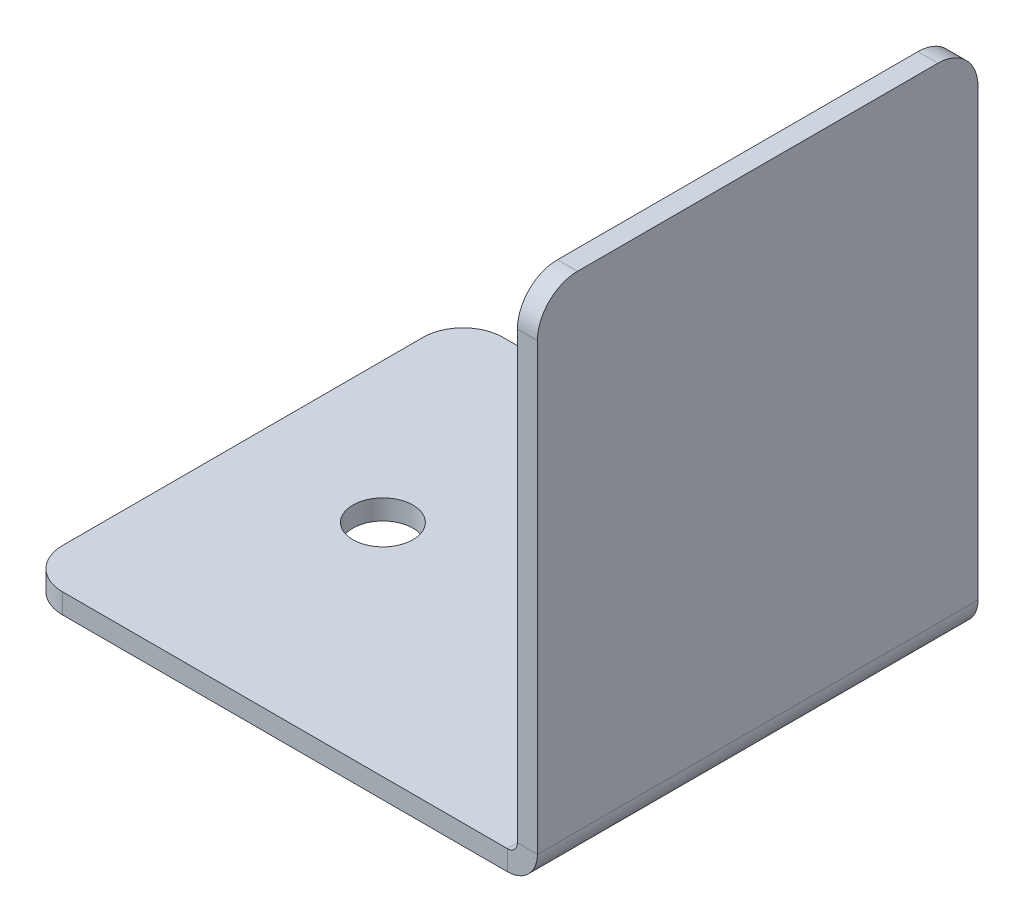
from build123d import *

# Parameters (mm, degrees)
SKETCH_1_W      = 50
SKETCH_1_H      = 22
SKETCH_1_R      = 1.5
EXTRUDE_1_DEPTH = 1
OTHER_START     = -10.142952565
OTHER_1_DEPTH   = 22
OTHER_1_2_DEPTH = 22
FILLET_1_R      = 2


# Read off the part's stored shape, not the designer's step: Нарисованный сгиб1
with BuildPart() as part:
    # Sketch 1 → Бобышка-Вытянуть1 (new body)
    with BuildSketch(Plane(origin=(0, 0, 0), x_dir=(1, 0, 0), z_dir=(0, 1, 0))):
        with Locations((0, -0.857047435)):
            Rectangle(SKETCH_1_W, SKETCH_1_H)
        with Locations(Location((-18, -0.857047435, 0), (0, 0, 270))):
            Circle(SKETCH_1_R, mode=Mode.SUBTRACT)
        with BuildLine():
            ThreePointArc((-5.514009268, -2.575584316), (-5.396296831, -0.857047435), (-5.514009268, 0.861489446))
            ThreePointArc((-5.514009268, 0.861489446), (-7.204527613, 2.142952565), (-8.485990732, 0.45243422))
            ThreePointArc((-8.485990732, 0.45243422), (-8.396296831, -0.857047435), (-8.485990732, -2.16652909))
            ThreePointArc((-8.485990732, -2.16652909), (-7.204527613, -3.857047435), (-5.514009268, -2.575584316))
        make_face(mode=Mode.SUBTRACT)
    extrude(amount=EXTRUDE_1_DEPTH)

    # Other 1 outline → Other 1 (cut)
    with BuildSketch(Plane.XY.offset(OTHER_START)):
        with BuildLine():
            Line((25, 1), (0.628815399, 1))
            ThreePointArc((0.628815399, 1), (0.08062724, 0.275255129), (-0.785398163, 0))
            Line((-0.785398163, 0), (25, 0))
            Line((25, 0), (25, 1))
        make_face()
    extrude(amount=OTHER_1_DEPTH, mode=Mode.SUBTRACT)

    # Other 1 2 outline → Other 1 2 (add)
    with BuildSketch(Plane.XY.offset(OTHER_START)):
        with BuildLine():
            Line((0.714601837, 1.5), (0.714601837, 25.714601837))
            Line((0.714601837, 25.714601837), (-0.285398163, 25.714601837))
            Line((-0.285398163, 25.714601837), (-0.285398163, 1.5))
            ThreePointArc((-0.285398163, 1.5), (-0.431844772, 1.146446609), (-0.785398163, 1))
            Line((-0.785398163, 1), (0.628815399, 1))
            ThreePointArc((0.628815399, 1), (0.692999676, 1.246347032), (0.714601837, 1.5))
        make_face()
    extrude(amount=OTHER_1_2_DEPTH)

    # Скругление1
    fillet_1_edges = [part.edges().sort_by_distance(p)[0] for p in [
        (0.214601837, 25.714601837, -10.142952565),
        (0.214601837, 25.714601837, 11.857047435),
        (-25, 0.5, 11.857047435),
        (-25, 0.5, -10.142952565),
    ]]
    fillet(fillet_1_edges, radius=FILLET_1_R)


solid = part.part
